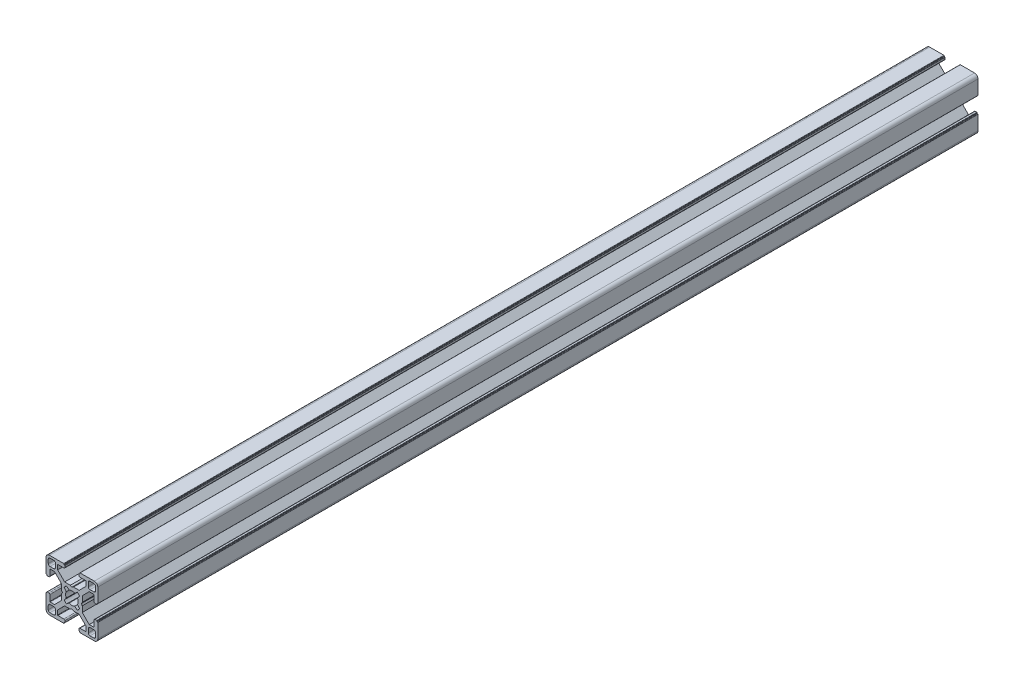
from build123d import *

# Parameters (mm, degrees)
DODANIE_WYCI_GNI_CIE1_DEPTH = 510


with BuildPart() as part:
    # Szkic1 → Dodanie-wyciągnięcie1 (new body)
    with BuildSketch(Plane.XY):
        with BuildLine():
            Line((96.56, 29.575148163), (97.459999946, 29.06))
            Line((97.459999946, 29.06), (100.764466193, 29.06))
            Line((100.764466193, 29.06), (104.810000327, 25.010000763))
            Line((104.810000327, 25.010000763), (104.810000327, 22.460001166))
            ThreePointArc((104.810000327, 22.460001166), (104.751421565, 22.318579525), (104.609999924, 22.260000763))
            Line((104.609999924, 22.260000763), (101.210000197, 22.260000763))
            ThreePointArc((101.210000197, 22.260000763), (100.785735989, 22.084264774), (100.61, 21.660000566))
            Line((100.61, 21.660000566), (100.61, 20.760000374))
            ThreePointArc((100.61, 20.760000374), (100.668578753, 20.618578753), (100.810000374, 20.56))
            Line((100.810000374, 20.56), (100.910000144, 20.56))
            ThreePointArc((100.910000144, 20.56), (101.05142109, 20.501421526), (101.109999564, 20.36000058))
            Line((101.109999564, 20.36000058), (101.109999564, 20.260000381))
            ThreePointArc((101.109999564, 20.260000381), (101.16857832, 20.118578755), (101.309999945, 20.06))
            Line((101.309999945, 20.06), (109.560000346, 20.06))
            ThreePointArc((109.560000346, 20.06), (110.974213664, 20.645786336), (111.56, 22.059999654))
            Line((111.56, 22.059999654), (111.56, 30.310000479))
            ThreePointArc((111.56, 30.310000479), (111.501421273, 30.451422036), (111.359999716, 30.510000763))
            Line((111.359999716, 30.510000763), (111.260000611, 30.510000763))
            ThreePointArc((111.260000611, 30.510000763), (111.118579054, 30.56857949), (111.060000327, 30.710001047))
            Line((111.060000327, 30.710001047), (111.060000327, 30.810000479))
            ThreePointArc((111.060000327, 30.810000479), (111.0014216, 30.951422036), (110.860000043, 31.010000763))
            Line((110.860000043, 31.010000763), (109.95999994, 31.010000763))
            ThreePointArc((109.95999994, 31.010000763), (109.535735606, 30.834264722), (109.359999564, 30.410000387))
            Line((109.359999564, 30.410000387), (109.359999564, 27.010000284))
            ThreePointArc((109.359999564, 27.010000284), (109.301420837, 26.868578727), (109.15999928, 26.81))
            Line((109.15999928, 26.81), (106.609999564, 26.81))
            Line((106.609999564, 26.81), (102.56446543, 30.855534134))
            Line((102.56446543, 30.855534134), (102.56446543, 34.160000381))
            Line((102.56446543, 34.160000381), (102.044852164, 35.06))
            Line((102.044852164, 35.06), (102.56446543, 35.959999619))
            Line((102.56446543, 35.959999619), (102.56446543, 39.264465866))
            Line((102.56446543, 39.264465866), (106.609999564, 43.31))
            Line((106.609999564, 43.31), (109.15999928, 43.31))
            ThreePointArc((109.15999928, 43.31), (109.301420837, 43.251421273), (109.359999564, 43.109999716))
            Line((109.359999564, 43.109999716), (109.359999564, 39.709999613))
            ThreePointArc((109.359999564, 39.709999613), (109.535735606, 39.285735278), (109.95999994, 39.109999237))
            Line((109.95999994, 39.109999237), (110.860000043, 39.109999237))
            ThreePointArc((110.860000043, 39.109999237), (111.0014216, 39.168577964), (111.060000327, 39.309999521))
            Line((111.060000327, 39.309999521), (111.060000327, 39.409998953))
            ThreePointArc((111.060000327, 39.409998953), (111.118579054, 39.55142051), (111.260000611, 39.609999237))
            Line((111.260000611, 39.609999237), (111.359999716, 39.609999237))
            ThreePointArc((111.359999716, 39.609999237), (111.501421273, 39.668577964), (111.56, 39.809999521))
            Line((111.56, 39.809999521), (111.56, 48.060000346))
            ThreePointArc((111.56, 48.060000346), (110.974213664, 49.474213664), (109.560000346, 50.06))
            Line((109.560000346, 50.06), (101.309999945, 50.06))
            ThreePointArc((101.309999945, 50.06), (101.16857832, 50.001421245), (101.109999564, 49.859999619))
            Line((101.109999564, 49.859999619), (101.109999564, 49.75999942))
            ThreePointArc((101.109999564, 49.75999942), (101.05142109, 49.618578474), (100.910000144, 49.56))
            Line((100.910000144, 49.56), (100.810000374, 49.56))
            ThreePointArc((100.810000374, 49.56), (100.668578753, 49.501421247), (100.61, 49.359999626))
            Line((100.61, 49.359999626), (100.61, 48.459999434))
            ThreePointArc((100.61, 48.459999434), (100.785735989, 48.035735226), (101.210000197, 47.859999237))
            Line((101.210000197, 47.859999237), (104.609999924, 47.859999237))
            ThreePointArc((104.609999924, 47.859999237), (104.751421565, 47.801420475), (104.810000327, 47.659998834))
            Line((104.810000327, 47.659998834), (104.810000327, 45.109999237))
            Line((104.810000327, 45.109999237), (100.764466193, 41.06))
            Line((100.764466193, 41.06), (97.459999946, 41.06))
            Line((97.459999946, 41.06), (96.56, 40.544851837))
            Line((96.56, 40.544851837), (95.660000054, 41.06))
            Line((95.660000054, 41.06), (92.355533807, 41.06))
            Line((92.355533807, 41.06), (88.309999673, 45.109999237))
            Line((88.309999673, 45.109999237), (88.309999673, 47.659998834))
            ThreePointArc((88.309999673, 47.659998834), (88.368578435, 47.801420475), (88.510000076, 47.859999237))
            Line((88.510000076, 47.859999237), (91.909999803, 47.859999237))
            ThreePointArc((91.909999803, 47.859999237), (92.334264011, 48.035735226), (92.51, 48.459999434))
            Line((92.51, 48.459999434), (92.51, 49.359999626))
            ThreePointArc((92.51, 49.359999626), (92.451421247, 49.501421247), (92.309999626, 49.56))
            Line((92.309999626, 49.56), (92.209999856, 49.56))
            ThreePointArc((92.209999856, 49.56), (92.06857891, 49.618578474), (92.010000436, 49.75999942))
            Line((92.010000436, 49.75999942), (92.010000436, 49.859999619))
            ThreePointArc((92.010000436, 49.859999619), (91.95142168, 50.001421245), (91.810000055, 50.06))
            Line((91.810000055, 50.06), (83.559999654, 50.06))
            ThreePointArc((83.559999654, 50.06), (82.145786336, 49.474213664), (81.56, 48.060000346))
            Line((81.56, 48.060000346), (81.56, 39.809999521))
            ThreePointArc((81.56, 39.809999521), (81.618578727, 39.668577964), (81.760000284, 39.609999237))
            Line((81.760000284, 39.609999237), (81.859999389, 39.609999237))
            ThreePointArc((81.859999389, 39.609999237), (82.001420946, 39.55142051), (82.059999673, 39.409998953))
            Line((82.059999673, 39.409998953), (82.059999673, 39.309999521))
            ThreePointArc((82.059999673, 39.309999521), (82.1185784, 39.168577964), (82.259999957, 39.109999237))
            Line((82.259999957, 39.109999237), (83.16000006, 39.109999237))
            ThreePointArc((83.16000006, 39.109999237), (83.584264394, 39.285735278), (83.760000436, 39.709999613))
            Line((83.760000436, 39.709999613), (83.760000436, 43.109999716))
            ThreePointArc((83.760000436, 43.109999716), (83.818579163, 43.251421273), (83.96000072, 43.31))
            Line((83.96000072, 43.31), (86.510000436, 43.31))
            Line((86.510000436, 43.31), (90.55553457, 39.264465866))
            Line((90.55553457, 39.264465866), (90.55553457, 35.959999619))
            Line((90.55553457, 35.959999619), (91.075147836, 35.06))
            Line((91.075147836, 35.06), (90.55553457, 34.160000381))
            Line((90.55553457, 34.160000381), (90.55553457, 30.855534134))
            Line((90.55553457, 30.855534134), (86.510000436, 26.81))
            Line((86.510000436, 26.81), (83.96000072, 26.81))
            ThreePointArc((83.96000072, 26.81), (83.818579163, 26.868578727), (83.760000436, 27.010000284))
            Line((83.760000436, 27.010000284), (83.760000436, 30.410000387))
            ThreePointArc((83.760000436, 30.410000387), (83.584264394, 30.834264722), (83.16000006, 31.010000763))
            Line((83.16000006, 31.010000763), (82.259999957, 31.010000763))
            ThreePointArc((82.259999957, 31.010000763), (82.1185784, 30.951422036), (82.059999673, 30.810000479))
            Line((82.059999673, 30.810000479), (82.059999673, 30.710001047))
            ThreePointArc((82.059999673, 30.710001047), (82.001420946, 30.56857949), (81.859999389, 30.510000763))
            Line((81.859999389, 30.510000763), (81.760000284, 30.510000763))
            ThreePointArc((81.760000284, 30.510000763), (81.618578727, 30.451422036), (81.56, 30.310000479))
            Line((81.56, 30.310000479), (81.56, 22.059999654))
            ThreePointArc((81.56, 22.059999654), (82.145786336, 20.645786336), (83.559999654, 20.06))
            Line((83.559999654, 20.06), (91.810000055, 20.06))
            ThreePointArc((91.810000055, 20.06), (91.95142168, 20.118578755), (92.010000436, 20.260000381))
            Line((92.010000436, 20.260000381), (92.010000436, 20.36000058))
            ThreePointArc((92.010000436, 20.36000058), (92.06857891, 20.501421526), (92.209999856, 20.56))
            Line((92.209999856, 20.56), (92.309999626, 20.56))
            ThreePointArc((92.309999626, 20.56), (92.451421247, 20.618578753), (92.51, 20.760000374))
            Line((92.51, 20.760000374), (92.51, 21.660000566))
            ThreePointArc((92.51, 21.660000566), (92.334264011, 22.084264774), (91.909999803, 22.260000763))
            Line((91.909999803, 22.260000763), (88.510000076, 22.260000763))
            ThreePointArc((88.510000076, 22.260000763), (88.368578435, 22.318579525), (88.309999673, 22.460001166))
            Line((88.309999673, 22.460001166), (88.309999673, 25.010000763))
            Line((88.309999673, 25.010000763), (92.355533807, 29.06))
            Line((92.355533807, 29.06), (95.660000054, 29.06))
            Line((95.660000054, 29.06), (96.56, 29.575148163))
        make_face()
        with BuildLine():
            Line((109.26000109, 48.760000398), (107.060000327, 48.760000398))
            ThreePointArc((107.060000327, 48.760000398), (106.352893543, 48.467107182), (106.060000327, 47.760000398))
            Line((106.060000327, 47.760000398), (106.060000327, 45.559999635))
            ThreePointArc((106.060000327, 45.559999635), (106.352893543, 44.852892851), (107.060000327, 44.559999635))
            Line((107.060000327, 44.559999635), (109.26000109, 44.559999635))
            ThreePointArc((109.26000109, 44.559999635), (109.967107874, 44.852892851), (110.26000109, 45.559999635))
            Line((110.26000109, 45.559999635), (110.26000109, 47.760000398))
            ThreePointArc((110.26000109, 47.760000398), (109.967107874, 48.467107182), (109.26000109, 48.760000398))
        make_face(mode=Mode.SUBTRACT)
        with BuildLine():
            Line((94.959870476, 38.340561767), (93.424070588, 39.578400903))
            ThreePointArc((93.424070588, 39.578400903), (92.678997741, 38.957155561), (92.054663108, 38.214669473))
            Line((92.054663108, 38.214669473), (93.279438268, 36.660129597))
            ThreePointArc((93.279438268, 36.660129597), (92.91, 35.06), (93.279438268, 33.459870403))
            Line((93.279438268, 33.459870403), (92.054663108, 31.905330527))
            ThreePointArc((92.054663108, 31.905330527), (92.678997741, 31.162844439), (93.424070588, 30.541599097))
            Line((93.424070588, 30.541599097), (94.959870476, 31.779438233))
            ThreePointArc((94.959870476, 31.779438233), (96.56, 31.41), (98.160129524, 31.779438233))
            Line((98.160129524, 31.779438233), (99.695929412, 30.541599097))
            ThreePointArc((99.695929412, 30.541599097), (100.441002259, 31.162844439), (101.065336892, 31.905330527))
            Line((101.065336892, 31.905330527), (99.840561732, 33.459870403))
            ThreePointArc((99.840561732, 33.459870403), (100.21, 35.06), (99.840561732, 36.660129597))
            Line((99.840561732, 36.660129597), (101.065336892, 38.214669473))
            ThreePointArc((101.065336892, 38.214669473), (100.441002259, 38.957155561), (99.695929412, 39.578400903))
            Line((99.695929412, 39.578400903), (98.160129524, 38.340561767))
            ThreePointArc((98.160129524, 38.340561767), (96.56, 38.71), (94.959870476, 38.340561767))
        make_face(mode=Mode.SUBTRACT)
        with BuildLine():
            Line((83.85999891, 21.359999602), (86.059999673, 21.359999602))
            ThreePointArc((86.059999673, 21.359999602), (86.767106457, 21.652892818), (87.059999673, 22.359999602))
            Line((87.059999673, 22.359999602), (87.059999673, 24.560000365))
            ThreePointArc((87.059999673, 24.560000365), (86.767106457, 25.267107149), (86.059999673, 25.560000365))
            Line((86.059999673, 25.560000365), (83.85999891, 25.560000365))
            ThreePointArc((83.85999891, 25.560000365), (83.152892126, 25.267107149), (82.85999891, 24.560000365))
            Line((82.85999891, 24.560000365), (82.85999891, 22.359999602))
            ThreePointArc((82.85999891, 22.359999602), (83.152892126, 21.652892818), (83.85999891, 21.359999602))
        make_face(mode=Mode.SUBTRACT)
        with BuildLine():
            Line((110.26000109, 22.359999602), (110.26000109, 24.560000365))
            ThreePointArc((110.26000109, 24.560000365), (109.967107874, 25.267107149), (109.26000109, 25.560000365))
            Line((109.26000109, 25.560000365), (107.060000327, 25.560000365))
            ThreePointArc((107.060000327, 25.560000365), (106.352893543, 25.267107149), (106.060000327, 24.560000365))
            Line((106.060000327, 24.560000365), (106.060000327, 22.359999602))
            ThreePointArc((106.060000327, 22.359999602), (106.352893543, 21.652892818), (107.060000327, 21.359999602))
            Line((107.060000327, 21.359999602), (109.26000109, 21.359999602))
            ThreePointArc((109.26000109, 21.359999602), (109.967107874, 21.652892818), (110.26000109, 22.359999602))
        make_face(mode=Mode.SUBTRACT)
        with BuildLine():
            Line((86.059999673, 48.760000398), (83.85999891, 48.760000398))
            ThreePointArc((83.85999891, 48.760000398), (83.152892126, 48.467107182), (82.85999891, 47.760000398))
            Line((82.85999891, 47.760000398), (82.85999891, 45.559999635))
            ThreePointArc((82.85999891, 45.559999635), (83.152892126, 44.852892851), (83.85999891, 44.559999635))
            Line((83.85999891, 44.559999635), (86.059999673, 44.559999635))
            ThreePointArc((86.059999673, 44.559999635), (86.767106457, 44.852892851), (87.059999673, 45.559999635))
            Line((87.059999673, 45.559999635), (87.059999673, 47.760000398))
            ThreePointArc((87.059999673, 47.760000398), (86.767106457, 48.467107182), (86.059999673, 48.760000398))
        make_face(mode=Mode.SUBTRACT)
    extrude(amount=DODANIE_WYCI_GNI_CIE1_DEPTH)


solid = part.part
